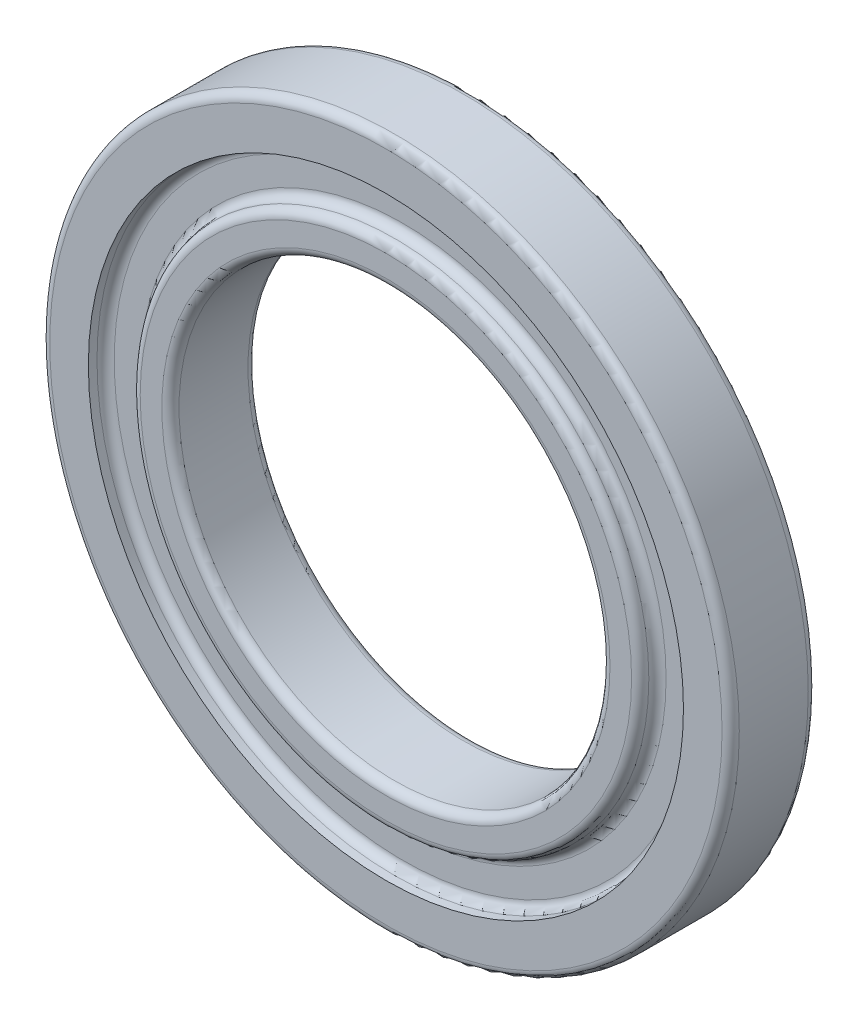
from build123d import *

# Parameters (mm, degrees)
SKETCH1_R           = 0.4
SKETCH1_R_2         = 0.25
BOSS_EXTRUDE1_DEPTH = 0.05
SKETCH2_R           = 0.345218632
SKETCH2_R_2         = 0.29506517
CUT_EXTRUDE1_DEPTH  = 0.02
FILLET1_R           = 0.01
FILLET2_R           = 0.01


with BuildPart() as part:
    # Sketch1 → Boss-Extrude1 (new, symmetric)
    with BuildSketch(Plane.XY):
        Circle(SKETCH1_R)
        Circle(SKETCH1_R_2, mode=Mode.SUBTRACT)
    extrude(amount=BOSS_EXTRUDE1_DEPTH, both=True)

    # Sketch2 → Cut-Extrude1 (cut)
    with BuildSketch(Plane.XY.offset(0.05)):
        Circle(SKETCH2_R)
        Circle(SKETCH2_R_2, mode=Mode.SUBTRACT)
    cut_extrude1 = extrude(amount=-CUT_EXTRUDE1_DEPTH, mode=Mode.SUBTRACT)

    # Mirror1: Cut-Extrude1 across plane
    add(cut_extrude1.mirror(Plane.XY), mode=Mode.SUBTRACT)

    # Fillet1
    fillet1_edges = [part.edges().sort_by_distance(p)[0] for p in [
        (-0.345218632, 0, 0.03),
        (-0.29506517, 0, 0.03),
        (-0.29506517, 0, 0.05),
        (-0.345218632, 0, -0.03),
        (-0.4, 0, -0.05),
        (-0.29506517, 0, -0.05),
        (-0.29506517, 0, -0.03),
        (-0.4, 0, 0.05),
    ]]
    fillet(fillet1_edges, radius=FILLET1_R - 0.0001)  # a hair under: the kernel refuses the full size

    # Fillet2
    fillet2_edges = [part.edges().sort_by_distance(p)[0] for p in [
        (-0.25, 0, -0.05),
        (-0.25, 0, 0.05),
    ]]
    fillet(fillet2_edges, radius=FILLET2_R)


solid = part.part
